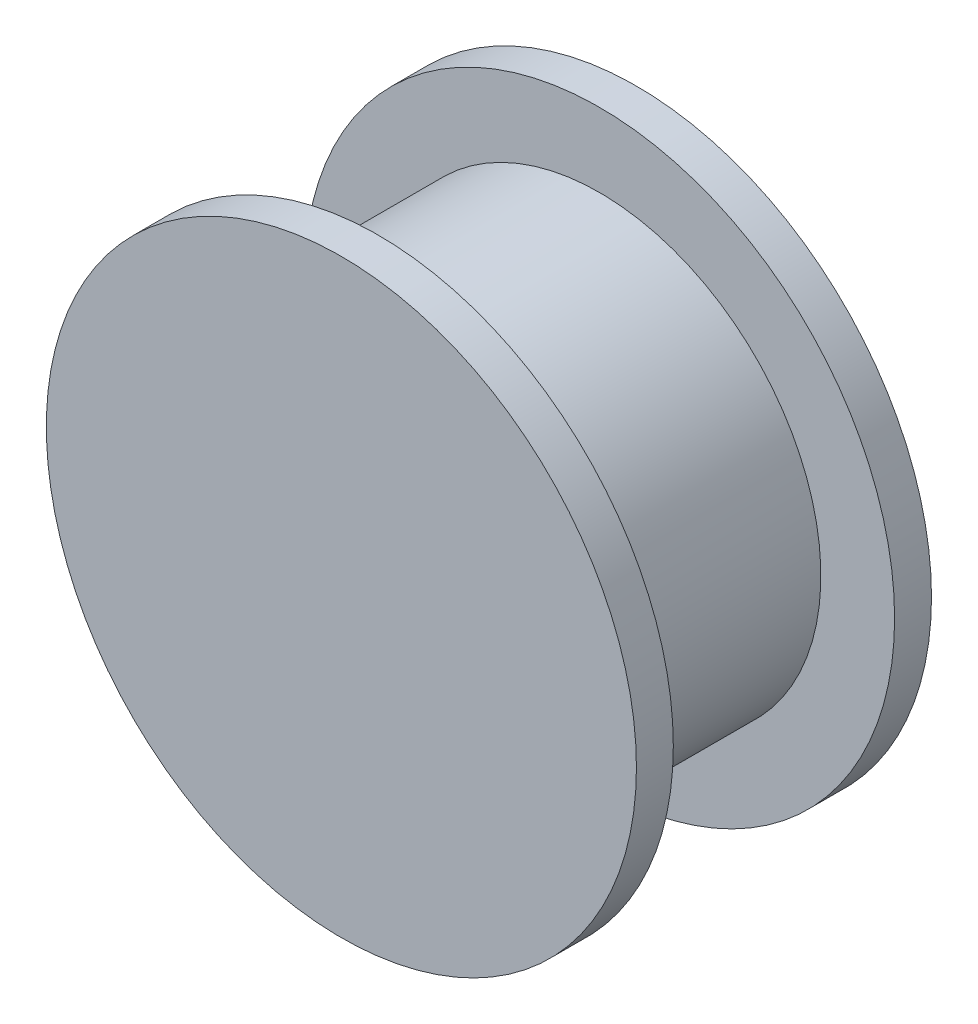
from build123d import *

# Parameters (mm, degrees)
SKETCH1_R           = 25.4
BOSS_EXTRUDE1_DEPTH = 3.175
SKETCH2_R           = 19.05
BOSS_EXTRUDE2_DEPTH = 19.05
SKETCH3_R           = 25.4
BOSS_EXTRUDE3_DEPTH = 3.175


with BuildPart() as part:
    # Sketch1 → Boss-Extrude1 (new body)
    with BuildSketch(Plane.XY):
        Circle(SKETCH1_R)
    extrude(amount=BOSS_EXTRUDE1_DEPTH)

    # Sketch2 → Boss-Extrude2 (add)
    with BuildSketch(Plane.XY.offset(3.175)):
        Circle(SKETCH2_R)
    extrude(amount=BOSS_EXTRUDE2_DEPTH)

    # Sketch3 → Boss-Extrude3 (add)
    with BuildSketch(Plane.XY.offset(22.225)):
        Circle(SKETCH3_R)
    extrude(amount=BOSS_EXTRUDE3_DEPTH)


solid = part.part
